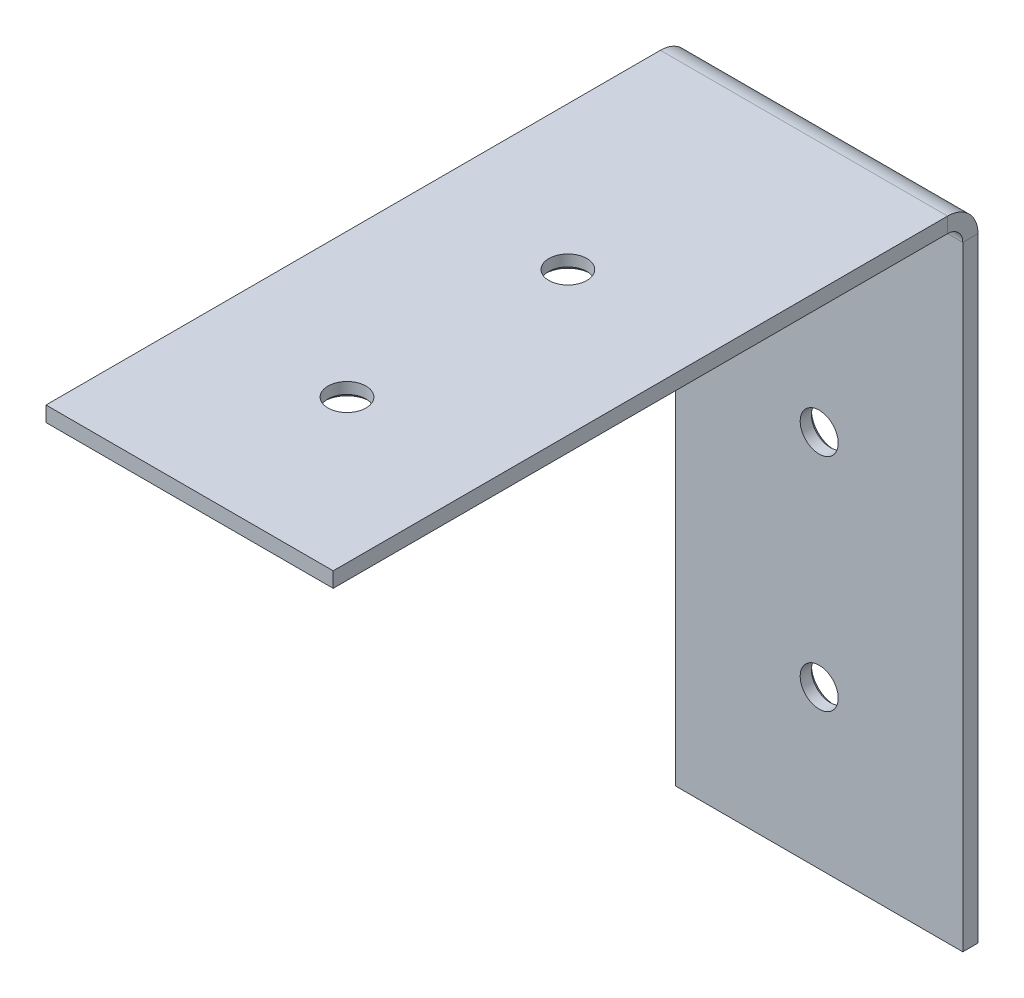
from build123d import *

# Parameters (mm, degrees)
SKETCH1_W                       = 37.75
SKETCH1_H                       = 82.76
BASE_FLANGE1_DEPTH              = 2
EDGE_FLANGE1_STRIP_W            = 12
EDGE_FLANGE1_STRIP_H            = 2
EDGE_FLANGE1_STRIP_CUT_DEPTH    = 37.75
EDGE_FLANGE1_DEPTH              = 37.75
M6X1_0_TAPPED_HOLE2_D           = 5
M6X1_0_TAPPED_HOLE2_DEPTH       = 15
M6X1_0_TAPPED_HOLE2_CSINK_D     = 6.05
M6X1_0_TAPPED_HOLE2_CSINK_ANGLE = 90
M6X1_0_TAPPED_HOLE2_TIP         = 1.502151548
M6X1_0_TAPPED_HOLE3_D           = 5
M6X1_0_TAPPED_HOLE3_DEPTH       = 15
M6X1_0_TAPPED_HOLE3_CSINK_D     = 6.05
M6X1_0_TAPPED_HOLE3_CSINK_ANGLE = 90
M6X1_0_TAPPED_HOLE3_TIP         = 1.502151548


# Sheet-metal steps are written as plain solids
with BuildPart() as part:
    # Sketch1 → Base-Flange1 (new body)
    with BuildSketch(Plane.XY):
        Rectangle(SKETCH1_W, SKETCH1_H)
    extrude(amount=-BASE_FLANGE1_DEPTH)

    # Edge-Flange1 strip (across the edge) → Edge-Flange1 strip cut (cut)
    with BuildSketch(Plane(origin=(18.875, 41.38, 0), x_dir=(0, -1, 0), z_dir=(-1, 0, 0))):
        with Locations((-4, -1)):
            Rectangle(EDGE_FLANGE1_STRIP_W, EDGE_FLANGE1_STRIP_H)
    extrude(amount=EDGE_FLANGE1_STRIP_CUT_DEPTH, mode=Mode.SUBTRACT)

    # Edge-Flange1 section (across the edge) → Edge-Flange1 (add)
    with BuildSketch(Plane(origin=(18.875, 41.38, 0), x_dir=(0, -1, 0), z_dir=(-1, 0, 0))):
        with BuildLine():
            Line((-2, 2), (-2, 82.76))
            Line((-2, 82.76), (0, 82.76))
            Line((0, 82.76), (0, 2))
            ThreePointArc((0, 2), (0.585786438, 0.585786438), (2, 0))
            Line((2, 0), (2, -2))
            ThreePointArc((2, -2), (-0.828427125, -0.828427125), (-2, 2))
        make_face()
    extrude(amount=EDGE_FLANGE1_DEPTH)

    # M6x1.0 Tapped Hole2
    with Locations(Plane(origin=(0, 0, -2), x_dir=(-1, 0, 0), z_dir=(0, 0, -1))):
        with Locations((0, 8.345), (0, -20.69)):
            CounterSinkHole(M6X1_0_TAPPED_HOLE2_D / 2, M6X1_0_TAPPED_HOLE2_CSINK_D / 2, depth=M6X1_0_TAPPED_HOLE2_DEPTH, counter_sink_angle=M6X1_0_TAPPED_HOLE2_CSINK_ANGLE)
            with Locations((0, 0, -(M6X1_0_TAPPED_HOLE2_DEPTH + M6X1_0_TAPPED_HOLE2_TIP / 2))):  # 118° drill point
                Cone(0, M6X1_0_TAPPED_HOLE2_D / 2, M6X1_0_TAPPED_HOLE2_TIP, mode=Mode.SUBTRACT)

    # M6x1.0 Tapped Hole3
    with Locations(Plane(origin=(0, 41.38, 0), x_dir=(-1, 0, 0), z_dir=(0, -1, 0))):
        with Locations((0, -33.035), (0, -62.07)):
            CounterSinkHole(M6X1_0_TAPPED_HOLE3_D / 2, M6X1_0_TAPPED_HOLE3_CSINK_D / 2, depth=M6X1_0_TAPPED_HOLE3_DEPTH, counter_sink_angle=M6X1_0_TAPPED_HOLE3_CSINK_ANGLE)
            with Locations((0, 0, -(M6X1_0_TAPPED_HOLE3_DEPTH + M6X1_0_TAPPED_HOLE3_TIP / 2))):  # 118° drill point
                Cone(0, M6X1_0_TAPPED_HOLE3_D / 2, M6X1_0_TAPPED_HOLE3_TIP, mode=Mode.SUBTRACT)


solid = part.part
